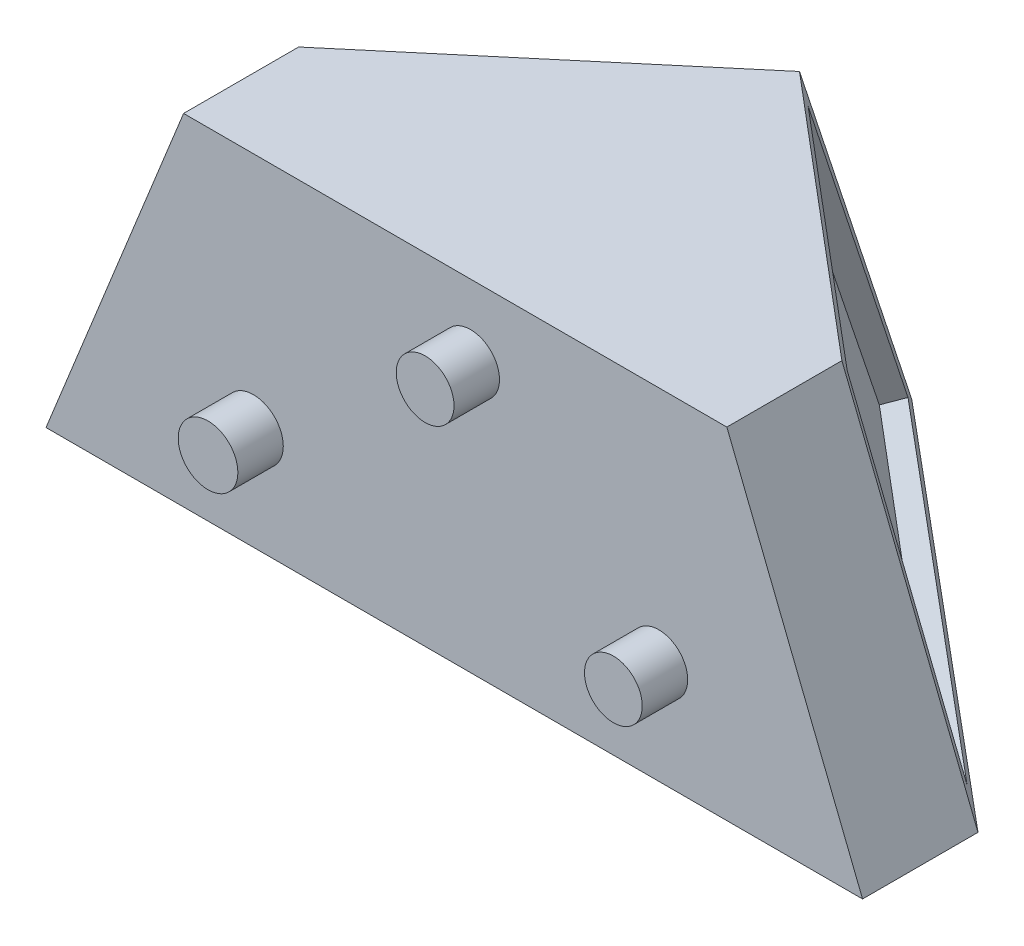
from build123d import *

# Parameters (mm, degrees)
SKETCH8_R           = 1.614382249
SKETCH8_R_2         = 1.666459096
BOSS_EXTRUDE1_DEPTH = 2.54
CUT_EXTRUDE1_DEPTH  = 1.27
CUT_EXTRUDE3_DEPTH  = 1.27


with BuildPart() as part:
    # Sketch7 → Loft1 section 0
    with BuildSketch(Plane(origin=(0, 19.05, 0), x_dir=(1, 0, 0), z_dir=(0, 1, 0))):
        with BuildLine():
            Line((2.329927564, -19.831697395), (-28.030874095, -19.831697395))
            Line((-28.030874095, -19.831697395), (-28.030874095, -13.401990643))
            Line((-28.030874095, -13.401990643), (-12.850473266, -0.591086342))
            Line((-12.850473266, -0.591086342), (2.329927564, -13.401990643))
            Line((2.329927564, -13.401990643), (2.329927564, -19.831697395))
        make_face()
    # Sketch1 → Loft1 section 1
    with BuildSketch(Plane(origin=(0, 0, 0), x_dir=(1, 0, 0), z_dir=(0, 1, 0))):
        with BuildLine():
            Line((-35.720948922, -19.831697395), (9.915848697, -19.831697395))
            Line((9.915848697, -19.831697395), (9.915848697, -13.380422339))
            Line((9.915848697, -13.380422339), (-12.902550112, 5.734466717))
            Line((-12.902550112, 5.734466717), (-35.720948922, -13.380422339))
            Line((-35.720948922, -13.380422339), (-35.720948922, -19.831697395))
        make_face()
    loft()

    # Sketch8 → Boss-Extrude1 (add)
    with BuildSketch(Plane.XY.offset(19.831697395)):
        with Locations((-11.991205294, 14.993068909)):
            Circle(SKETCH8_R)
        with Locations((-1.47168225, 5.723390187)):
            Circle(SKETCH8_R)
        with Locations((-24.125110588, 5.723390187)):
            Circle(SKETCH8_R_2)
    extrude(amount=BOSS_EXTRUDE1_DEPTH)

    # Sketch10 → Cut-Extrude1 (cut)
    with BuildSketch(Plane(origin=(-2.316668622, -0.925631174, 2.745158144), x_dir=(-0.7809926786782739, 0.19954822136443426, -0.5918031287524808), z_dir=(0.6245401795328581, 0.2495367072226862, -0.7400547249342612))):
        Polygon((-5.325710862, 21.043562966), (-13.739013708, 5.028281727), (12.35928027, -0.480841902), (12.35928027, 17.367594826), align=None)
    extrude(amount=-CUT_EXTRUDE1_DEPTH, mode=Mode.SUBTRACT)

    # Sketch14 → Cut-Extrude3 (cut)
    with BuildSketch(Plane(origin=(-7.735349681, 3.132971893, -9.166074927), x_dir=(-0.7814202870497631, -0.2018218164714577, 0.5904661627758421), z_dir=(-0.6240050760907847, 0.25273458150056255, -0.7394206491075764))):
        Polygon((34.101698791, 5.249617187), (25.261874217, 21.574256729), (7.477459861, 17.716608027), (7.477459861, -0.525493463), align=None)
    extrude(amount=-CUT_EXTRUDE3_DEPTH, mode=Mode.SUBTRACT)

    # Shell1: read off the stored shape, not the designer's step
    # Shell1: loft between two sections, ruled curve by curve
    shell1_from = [
        Edge.make_line((-32.981801445, 0, 17.291697395), (-32.981801445, 0, 16.221508901)),
        Edge.make_line((7.181869263, 0, 16.221455471), (7.181869263, 0, 17.291697395)),
        Edge.make_line((-32.981801445, 0, 17.291697395), (7.181869263, 0, 17.291697395)),
        Edge.make_line((7.181869263, 0, 16.221455471), (-12.899934435, 0, -0.725795677)),
        Edge.make_line((-32.981801445, 0, 16.221508901), (-12.899934435, 0, -0.725795677)),
    ]
    shell1_to = [
        Edge.make_line((-26.317069927, 16.51, 17.291697395), (-26.317069927, 16.51, 16.240201431)),
        Edge.make_line((0.607404281, 16.51, 16.240148002), (0.607404281, 16.51, 17.291697395)),
        Edge.make_line((-26.317069927, 16.51, 17.291697395), (0.607404281, 16.51, 17.291697395)),
        Edge.make_line((0.607404281, 16.51, 16.240148002), (-12.854801168, 16.51, 4.879247349)),
        Edge.make_line((-26.317069927, 16.51, 16.240201431), (-12.854801168, 16.51, 4.879247349)),
    ]
    shell1 = Solid(Shell([*[Face.make_surface_from_curves(shell1_from[k], shell1_to[k]) for k in range(5)], Face(Wire(shell1_from)), Face(Wire(shell1_to))]))
    add(shell1, mode=Mode.SUBTRACT)


solid = part.part
